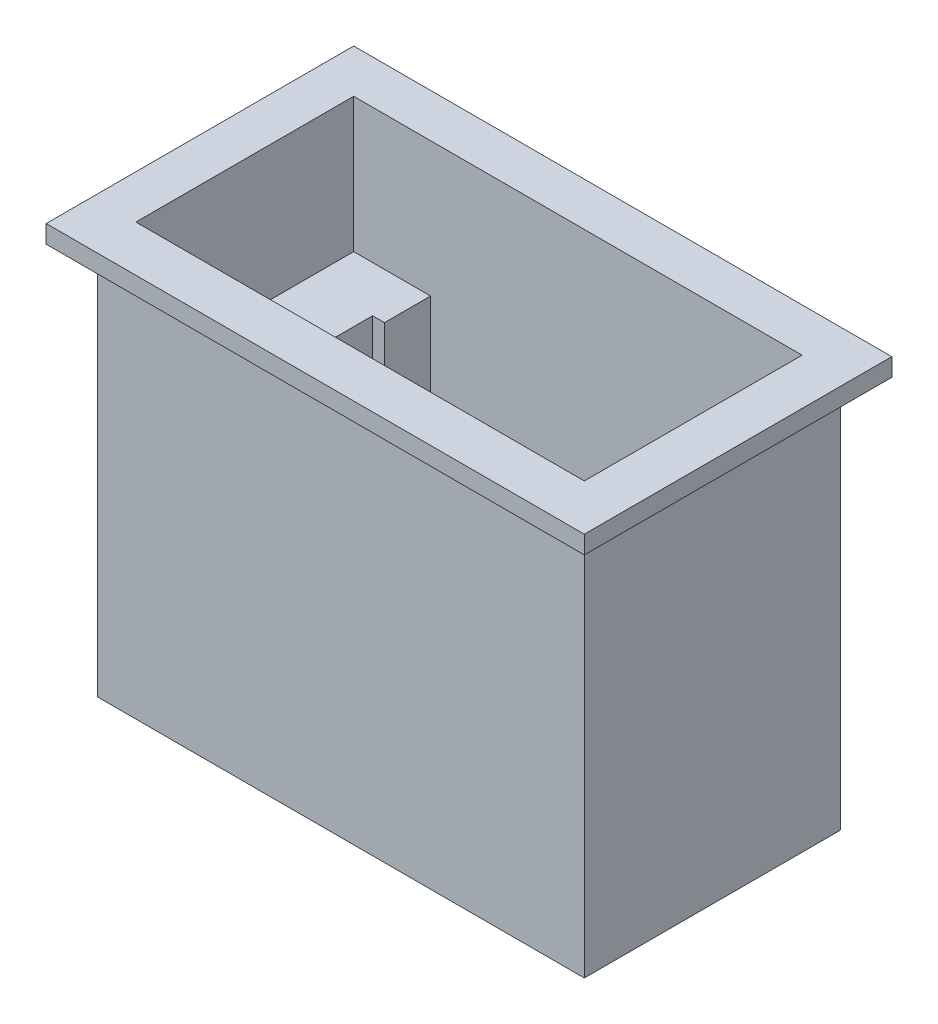
from build123d import *

# Parameters (mm, degrees)
SKETCH1_W           = 38
SKETCH1_H           = 20
BOSS_EXTRUDE1_DEPTH = 32
SKETCH2_W           = 35
SKETCH2_H           = 17
CUT_EXTRUDE1_DEPTH  = 28
SKETCH3_W           = 6
SKETCH3_H           = 17
BOSS_EXTRUDE2_DEPTH = 17.5
SKETCH4_W           = 42
SKETCH4_H           = 24
SKETCH4_W_2         = 38
SKETCH4_H_2         = 20
EXTRUDE_THIN2_DEPTH = 1.4
SKETCH5_R           = 1
CUT_EXTRUDE2_DEPTH  = 3
SKETCH6_R           = 1
CUT_EXTRUDE3_DEPTH  = 3
SKETCH7_W           = 2.5
SKETCH7_H           = 8
CUT_EXTRUDE4_DEPTH  = 40.952995341


with BuildPart() as part:
    # Sketch1 → Boss-Extrude1 (new body)
    with BuildSketch(Plane(origin=(0, 0, 0), x_dir=(1, 0, 0), z_dir=(0, 1, 0))):
        with Locations((8.6, -4.057142857)):
            Rectangle(SKETCH1_W, SKETCH1_H)
    extrude(amount=BOSS_EXTRUDE1_DEPTH)

    # Sketch2 → Cut-Extrude1 (cut)
    with BuildSketch(Plane(origin=(0, 32, 0), x_dir=(1, 0, 0), z_dir=(0, 1, 0))):
        with Locations((8.5, -3.957142857)):
            Rectangle(SKETCH2_W, SKETCH2_H)
    extrude(amount=-CUT_EXTRUDE1_DEPTH, mode=Mode.SUBTRACT)

    # Sketch3 → Boss-Extrude2 (add)
    with BuildSketch(Plane(origin=(0, 4, 0), x_dir=(1, 0, 0), z_dir=(0, 1, 0))):
        with Locations((-6, -3.957142857)):
            Rectangle(SKETCH3_W, SKETCH3_H)
        with Locations((23, -3.957142857)):
            Rectangle(SKETCH3_W, SKETCH3_H)
    extrude(amount=BOSS_EXTRUDE2_DEPTH)

    # Sketch4 → Extrude-Thin2 (add)
    with BuildSketch(Plane(origin=(0, 32, 0), x_dir=(1, 0, 0), z_dir=(0, 1, 0))):
        with Locations((8.6, -4.057142857)):
            Rectangle(SKETCH4_W, SKETCH4_H)
        with Locations((8.6, -4.057142857)):
            Rectangle(SKETCH4_W_2, SKETCH4_H_2, mode=Mode.SUBTRACT)
    extrude(amount=-EXTRUDE_THIN2_DEPTH)

    # Sketch5 → Cut-Extrude2 (cut)
    with BuildSketch(Plane(origin=(0, 21.5, 0), x_dir=(1, 0, 0), z_dir=(0, 1, 0))):
        with Locations((-5.5, -3.892148731)):
            Circle(SKETCH5_R)
    extrude(amount=-CUT_EXTRUDE2_DEPTH, mode=Mode.SUBTRACT)

    # Sketch6 → Cut-Extrude3 (cut)
    with BuildSketch(Plane(origin=(0, 21.5, 0), x_dir=(1, 0, 0), z_dir=(0, 1, 0))):
        with Locations((22.953148274, -4.115727136)):
            Circle(SKETCH6_R)
    extrude(amount=-CUT_EXTRUDE3_DEPTH, mode=Mode.SUBTRACT)

    # Sketch7 → Cut-Extrude4 (cut, through all)
    with BuildSketch(Plane(origin=(0, 21.5, 0), x_dir=(1, 0, 0), z_dir=(0, 1, 0))):
        with Locations((-2.67778097, -3.056278961)):
            Rectangle(SKETCH7_W, SKETCH7_H)
    extrude(amount=-CUT_EXTRUDE4_DEPTH, mode=Mode.SUBTRACT)


solid = part.part
